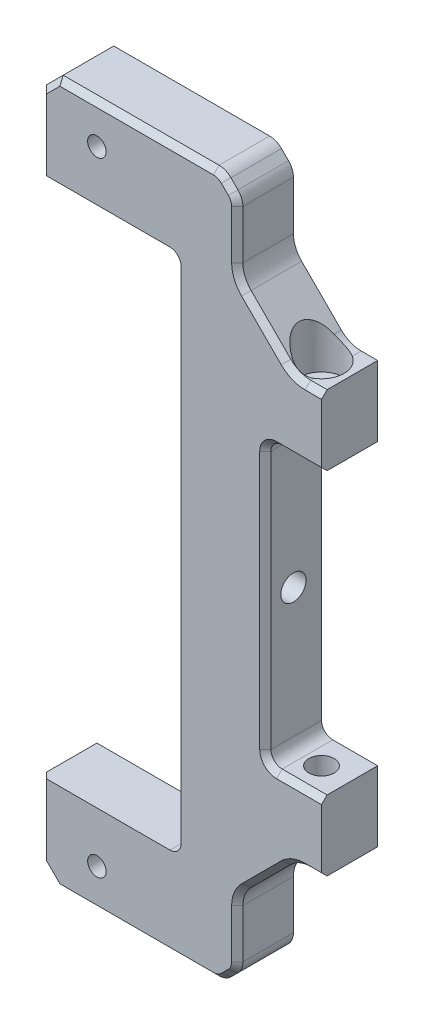
from build123d import *

# Parameters (mm, degrees)
SKETCH1_W                                            = 50
SKETCH1_H                                            = 125
BOSS_EXTRUDE1_DEPTH                                  = 5
SKETCH2_W                                            = 25
SKETCH2_H                                            = 93
CUT_EXTRUDE1_DEPTH                                   = 69.053287944
SKETCH3_W                                            = 10
SKETCH3_H                                            = 50
CUT_EXTRUDE2_DEPTH                                   = 69.053287944
CUT_EXTRUDE3_DEPTH                                   = 2
M4_TAPPED_HOLE1_D                                    = 3.3
SKETCH7_W                                            = 15
SKETCH7_H                                            = 25
CUT_EXTRUDE4_DEPTH                                   = 69.053287944
CBORE_FOR_M4_SLOTTED_CHEESE_HEAD_SCREWS2_D           = 4.5
CBORE_FOR_M4_SLOTTED_CHEESE_HEAD_SCREWS2_CBORE_D     = 8
CBORE_FOR_M4_SLOTTED_CHEESE_HEAD_SCREWS2_CBORE_DEPTH = 4.6
CBORE_FOR_M4_SLOTTED_CHEESE_HEAD_SCREWS3_D           = 4.5
CBORE_FOR_M4_SLOTTED_CHEESE_HEAD_SCREWS3_CBORE_D     = 8
CBORE_FOR_M4_SLOTTED_CHEESE_HEAD_SCREWS3_CBORE_DEPTH = 4.6
CHAMFER1_SIZE                                        = 10
FILLET1_R                                            = 5
FILLET2_R                                            = 2
CHAMFER2_SIZE                                        = 3
FILLET3_R                                            = 3
CHAMFER3_SIZE                                        = 1


# Some blends are built 0.0001 mm under size
with BuildPart() as part:
    # Sketch1 → Boss-Extrude1 (new, symmetric)
    with BuildSketch(Plane.XY):
        Rectangle(SKETCH1_W, SKETCH1_H)
    extrude(amount=BOSS_EXTRUDE1_DEPTH, both=True)

    # Sketch2 → Cut-Extrude1 (cut, through all)
    with BuildSketch(Plane.XY.offset(5)):
        with Locations((-12.5, 0)):
            Rectangle(SKETCH2_W, SKETCH2_H)
    extrude(amount=-CUT_EXTRUDE1_DEPTH, mode=Mode.SUBTRACT)

    # Sketch3 → Cut-Extrude2 (cut, through all)
    with BuildSketch(Plane.XY.offset(5)):
        with Locations((20, 0)):
            Rectangle(SKETCH3_W, SKETCH3_H)
    extrude(amount=-CUT_EXTRUDE2_DEPTH, mode=Mode.SUBTRACT)

    # Sketch4 → Cut-Extrude3 (cut)
    with BuildSketch(Plane(origin=(0, 0, -5), x_dir=(-1, 0, 0), z_dir=(0, 0, -1))):
        with BuildLine():
            Line((9.5, -57.5), (12.763932023, -57.5))
            ThreePointArc((12.763932023, -57.5), (12, -55.5), (12.763932023, -53.5))
            Line((12.763932023, -53.5), (9.5, -53.5))
            ThreePointArc((9.5, -53.5), (7.5, -55.5), (9.5, -57.5))
        make_face()
        with BuildLine():
            Line((12.763932023, -57.5), (17.236067977, -57.5))
            ThreePointArc((17.236067977, -57.5), (17.802517077, -56.570466269), (18, -55.5))
            ThreePointArc((18, -55.5), (17.802517077, -54.429533731), (17.236067977, -53.5))
            Line((17.236067977, -53.5), (12.763932023, -53.5))
            ThreePointArc((12.763932023, -53.5), (12, -55.5), (12.763932023, -57.5))
        make_face()
        with BuildLine():
            Line((12.763932023, -53.5), (17.236067977, -53.5))
            ThreePointArc((17.236067977, -53.5), (15, -52.5), (12.763932023, -53.5))
        make_face()
        with BuildLine():
            Line((17.236067977, -57.5), (20.5, -57.5))
            ThreePointArc((20.5, -57.5), (22.5, -55.5), (20.5, -53.5))
            Line((20.5, -53.5), (17.236067977, -53.5))
            ThreePointArc((17.236067977, -53.5), (17.802517077, -54.429533731), (18, -55.5))
            ThreePointArc((18, -55.5), (17.802517077, -56.570466269), (17.236067977, -57.5))
        make_face()
        with BuildLine():
            ThreePointArc((12.763932023, -57.5), (15, -58.5), (17.236067977, -57.5))
            Line((17.236067977, -57.5), (12.763932023, -57.5))
        make_face()
        with BuildLine():
            ThreePointArc((12.763932023, 53.5), (12, 55.5), (12.763932023, 57.5))
            Line((12.763932023, 57.5), (9.5, 57.5))
            ThreePointArc((9.5, 57.5), (7.5, 55.5), (9.5, 53.5))
            Line((9.5, 53.5), (12.763932023, 53.5))
        make_face()
        with BuildLine():
            Line((12.763932023, 57.5), (17.236067977, 57.5))
            ThreePointArc((17.236067977, 57.5), (15, 58.5), (12.763932023, 57.5))
        make_face()
        with BuildLine():
            ThreePointArc((18, 55.5), (17.802517077, 56.570466269), (17.236067977, 57.5))
            Line((17.236067977, 57.5), (12.763932023, 57.5))
            ThreePointArc((12.763932023, 57.5), (12, 55.5), (12.763932023, 53.5))
            Line((12.763932023, 53.5), (17.236067977, 53.5))
            ThreePointArc((17.236067977, 53.5), (17.802517077, 54.429533731), (18, 55.5))
        make_face()
        with BuildLine():
            ThreePointArc((20.5, 53.5), (22.5, 55.5), (20.5, 57.5))
            Line((20.5, 57.5), (17.236067977, 57.5))
            ThreePointArc((17.236067977, 57.5), (17.802517077, 56.570466269), (18, 55.5))
            ThreePointArc((18, 55.5), (17.802517077, 54.429533731), (17.236067977, 53.5))
            Line((17.236067977, 53.5), (20.5, 53.5))
        make_face()
        with BuildLine():
            ThreePointArc((12.763932023, 53.5), (15, 52.5), (17.236067977, 53.5))
            Line((17.236067977, 53.5), (12.763932023, 53.5))
        make_face()
    extrude(amount=-CUT_EXTRUDE3_DEPTH, mode=Mode.SUBTRACT)

    # M4 Tapped Hole1 (through all)
    with Locations(Plane(origin=(0, 0, -5), x_dir=(-1, 0, 0), z_dir=(0, 0, -1))):
        with Locations((15, -55.5), (15, 55.5)):
            Hole(M4_TAPPED_HOLE1_D / 2)

    # Sketch7 → Cut-Extrude4 (cut, through all)
    with BuildSketch(Plane(origin=(0, 0, -5), x_dir=(-1, 0, 0), z_dir=(0, 0, -1))):
        with Locations((-17.5, -50)):
            Rectangle(SKETCH7_W, SKETCH7_H)
        with Locations((-17.5, 50)):
            Rectangle(SKETCH7_W, SKETCH7_H)
    extrude(amount=-CUT_EXTRUDE4_DEPTH, mode=Mode.SUBTRACT)

    # CBORE for M4 Slotted cheese head screws2 (through all)
    with Locations(Plane(origin=(0, -37.5, 0), x_dir=(-1, 0, 0), z_dir=(0, -1, 0))):
        with Locations((-20, 0)):
            cbore_for_m4_slotted_cheese_head_screws2 = CounterBoreHole(CBORE_FOR_M4_SLOTTED_CHEESE_HEAD_SCREWS2_D / 2, CBORE_FOR_M4_SLOTTED_CHEESE_HEAD_SCREWS2_CBORE_D / 2, CBORE_FOR_M4_SLOTTED_CHEESE_HEAD_SCREWS2_CBORE_DEPTH)

    # CBORE for M4 Slotted cheese head screws3 (through all)
    with Locations(Plane.ZY):
        with Locations((0, 0)):
            CounterBoreHole(CBORE_FOR_M4_SLOTTED_CHEESE_HEAD_SCREWS3_D / 2, CBORE_FOR_M4_SLOTTED_CHEESE_HEAD_SCREWS3_CBORE_D / 2, CBORE_FOR_M4_SLOTTED_CHEESE_HEAD_SCREWS3_CBORE_DEPTH)

    # Mirror1: CBORE for M4 Slotted cheese head screws2 across plane
    add(cbore_for_m4_slotted_cheese_head_screws2.mirror(Plane.ZX), mode=Mode.SUBTRACT)

    # Chamfer1
    # the kernel refuses this chamfer: 10 mm, written as the material it adds along each edge
    with BuildSketch(Plane(origin=(10, -37.5, -5), x_dir=(-0.027495876610586317, -0.9996219169112968, 0), z_dir=(0, 0, 1))) as chamfer1_piece_1_section:
        Polygon((CHAMFER1_SIZE * 0.999621916911, CHAMFER1_SIZE * 0.0274958766106), (-CHAMFER1_SIZE * 0.0274958766106, CHAMFER1_SIZE * 0.999621916911), (0, 0), align=None)
    chamfer1_piece_1 = extrude(amount=10, mode=Mode.PRIVATE)
    chamfer1_piece_1 = chamfer1_piece_1 - Plane(origin=(20, -41.045650517, 0), x_dir=(-1, 0, 0), z_dir=(0, -1, 0)) * Cylinder(4, 60, mode=Mode.PRIVATE)
    add(chamfer1_piece_1)
    with BuildSketch(Plane(origin=(10, 37.5, -5), x_dir=(-0.027495876610586317, 0.9996219169112968, 0), z_dir=(0, 0, 1))) as chamfer1_piece_2_section:
        Polygon((CHAMFER1_SIZE * 0.999621916911, -CHAMFER1_SIZE * 0.0274958766106), (-CHAMFER1_SIZE * 0.0274958766106, -CHAMFER1_SIZE * 0.999621916911), (0, 0), align=None)
    chamfer1_piece_2 = extrude(amount=10, mode=Mode.PRIVATE)
    chamfer1_piece_2 = chamfer1_piece_2 - Plane(origin=(20, 41.045650517, 0), x_dir=(-1, 0, 0), z_dir=(0, 1, 0)) * Cylinder(4, 60, mode=Mode.PRIVATE)
    add(chamfer1_piece_2)

    # Fillet1
    # the kernel refuses this fillet: 5 mm, written as the material it adds along each edge
    with BuildSketch(Plane(origin=(10, -47.5, -5), x_dir=(0.707106781186831, 0.707106781186264, 0), z_dir=(0, 0, 1))) as fillet1_piece_1:
        with BuildLine():
            CenterArc((FILLET1_R * 0.414213562373, -FILLET1_R), FILLET1_R, 90, 45)
            Line((-FILLET1_R * 0.292893218814, -FILLET1_R * 0.292893218814), (0, 0))
            Line((0, 0), (FILLET1_R * 0.414213562373, 0))
        make_face()
    extrude(amount=10)
    with BuildSketch(Plane(origin=(20, -37.5, -5), x_dir=(-0.7071067811868298, -0.7071067811862654, 0), z_dir=(0, 0, 1))) as fillet1_piece_2_section:
        with BuildLine():
            CenterArc((FILLET1_R * 0.414213562373, FILLET1_R), FILLET1_R, 225, 45)
            Line((-FILLET1_R * 0.292893218813, FILLET1_R * 0.292893218813), (0, 0))
            Line((0, 0), (FILLET1_R * 0.414213562373, 0))
        make_face()
    fillet1_piece_2 = extrude(amount=6.17766953, mode=Mode.PRIVATE)
    fillet1_piece_2 = fillet1_piece_2 - Plane(origin=(20, -37.809724496, 0), x_dir=(-1, 0, 0), z_dir=(0, -1, 0)) * Cylinder(4, 21, mode=Mode.PRIVATE)
    add(fillet1_piece_2)
    with BuildSketch(Plane(origin=(10, 47.5, -5), x_dir=(0.707106781186831, -0.707106781186264, 0), z_dir=(0, 0, 1))) as fillet1_piece_3:
        with BuildLine():
            CenterArc((FILLET1_R * 0.414213562373, FILLET1_R), FILLET1_R, 225, 45)
            Line((-FILLET1_R * 0.292893218814, FILLET1_R * 0.292893218814), (0, 0))
            Line((0, 0), (FILLET1_R * 0.414213562373, 0))
        make_face()
    extrude(amount=10)
    with BuildSketch(Plane(origin=(20, 37.5, -5), x_dir=(-0.7071067811868298, 0.7071067811862654, 0), z_dir=(0, 0, 1))) as fillet1_piece_4_section:
        with BuildLine():
            CenterArc((FILLET1_R * 0.414213562373, -FILLET1_R), FILLET1_R, 90, 45)
            Line((-FILLET1_R * 0.292893218813, -FILLET1_R * 0.292893218813), (0, 0))
            Line((0, 0), (FILLET1_R * 0.414213562373, 0))
        make_face()
    fillet1_piece_4 = extrude(amount=6.17766953, mode=Mode.PRIVATE)
    fillet1_piece_4 = fillet1_piece_4 - Plane(origin=(20, 37.8097245, 0), x_dir=(-1, 0, 0), z_dir=(0, 1, 0)) * Cylinder(4, 21, mode=Mode.PRIVATE)
    add(fillet1_piece_4)
    with BuildSketch(Plane(origin=(20, -37.5, -1.17766953), x_dir=(-0.7071067811868306, -0.7071067811862645, 0), z_dir=(0, 0, 1))) as fillet1_piece_5_section:
        with BuildLine():
            CenterArc((FILLET1_R * 0.414213562373, FILLET1_R), FILLET1_R, 225, 45)
            Line((-FILLET1_R * 0.292893218813, FILLET1_R * 0.292893218813), (0, 0))
            Line((0, 0), (FILLET1_R * 0.414213562373, 0))
        make_face()
    fillet1_piece_5 = extrude(amount=6.17766953, mode=Mode.PRIVATE)
    fillet1_piece_5 = fillet1_piece_5 - Plane(origin=(20, -37.8097245, 0), x_dir=(-1, 0, 0), z_dir=(0, -1, 0)) * Cylinder(4, 21, mode=Mode.PRIVATE)
    add(fillet1_piece_5)
    with BuildSketch(Plane(origin=(20, 37.5, -1.17766953), x_dir=(-0.7071067811868306, 0.7071067811862645, 0), z_dir=(0, 0, 1))) as fillet1_piece_6_section:
        with BuildLine():
            CenterArc((FILLET1_R * 0.414213562373, -FILLET1_R), FILLET1_R, 90, 45)
            Line((-FILLET1_R * 0.292893218813, -FILLET1_R * 0.292893218813), (0, 0))
            Line((0, 0), (FILLET1_R * 0.414213562373, 0))
        make_face()
    fillet1_piece_6 = extrude(amount=6.17766953, mode=Mode.PRIVATE)
    fillet1_piece_6 = fillet1_piece_6 - Plane(origin=(20, 37.809724496, 0), x_dir=(-1, 0, 0), z_dir=(0, 1, 0)) * Cylinder(4, 21, mode=Mode.PRIVATE)
    add(fillet1_piece_6)

    # Fillet2
    fillet2_edges = [part.edges().sort_by_distance(p)[0] for p in [
        (0, 46.5, 0),
        (0, -46.5, 0),
        (15, -25, 0),
        (15, 25, 0),
    ]]
    fillet(fillet2_edges, radius=FILLET2_R)

    # Chamfer2
    chamfer2_edges = [part.edges().sort_by_distance(p)[0] for p in [
        (10, -62.5, 0),
        (10, 62.5, 0),
        (-25, 62.5, 0),
        (-25, -62.5, 0),
    ]]
    chamfer(chamfer2_edges, length=CHAMFER2_SIZE)

    # Fillet3
    fillet3_edges = [part.edges().sort_by_distance(p)[0] for p in [
        (7, -62.5, 0),
        (7, 62.5, 0),
        (10, -59.5, 0),
        (10, 59.5, 0),
    ]]
    fillet(fillet3_edges, radius=FILLET3_R)

    # Chamfer3
    chamfer3_edges = [part.edges().sort_by_distance(p)[0] for p in [
        (23.535533906, 37.5, 5),
        (-25, -53, 5),
        (15, -42.5, 5),
        (23.535533906, -37.5, 5),
        (10, 53.914213562, 5),
        (15, 42.5, 5),
        (10.380602337, -47.65765065, 5),
        (20.15765065, -37.880602337, 5),
        (10.380602337, 47.65765065, 5),
        (20.15765065, 37.880602337, 5),
        (15, 0, 5),
        (21, -25, 5),
        (15.585786438, 24.414213562, 5),
        (15.585786438, -24.414213562, 5),
        (-8.121320344, -62.5, 5),
        (-8.121320344, 62.5, 5),
        (-25, 53, 5),
        (-23.5, 61, 5),
        (-23.5, -61, 5),
        (8.5, 61, 5),
        (8.5, -61, 5),
        (10, -53.914213562, 5),
        (6.90540961, -62.271638598, 5),
        (9.771638598, -59.40540961, 5),
        (9.771638598, 59.40540961, 5),
        (6.90540961, 62.271638598, 5),
        (21, 25, 5),
    ]]
    chamfer(chamfer3_edges, length=CHAMFER3_SIZE - 0.0001)  # a hair under: the kernel refuses the full size


solid = part.part
